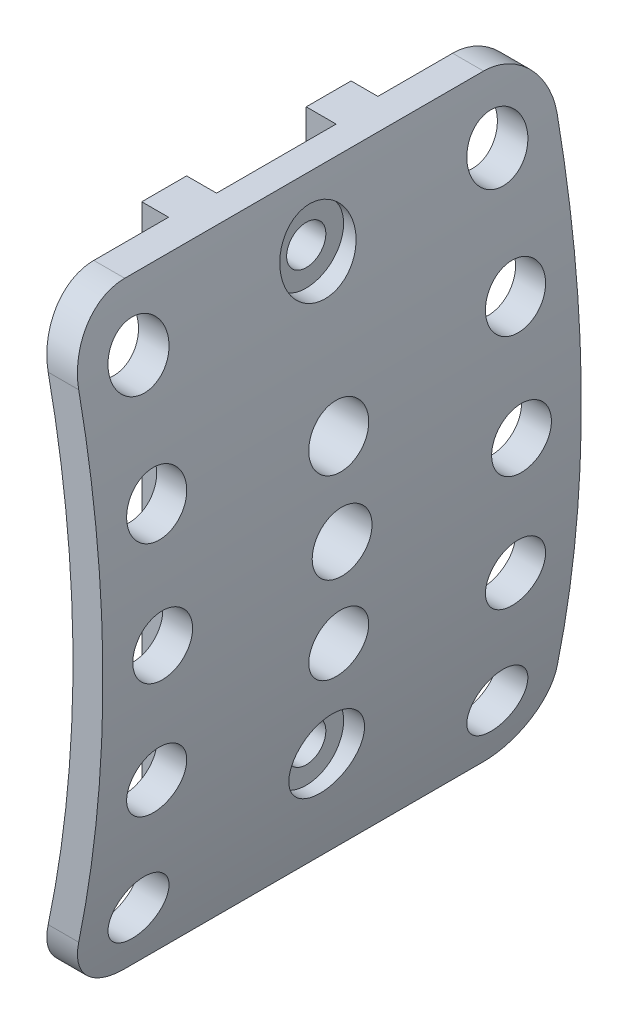
from build123d import *

# Parameters (mm, degrees)
BOSS_EXTRUDE1_DEPTH      = 25.4
BOSS_EXTRUDE1_DEPTH_BACK = 25.4
FILLET1_R                = 6.35
SKETCH4_R                = 2.0828
CUT_EXTRUDE1_DEPTH       = 42.910000161
SKETCH5_W                = 12.7
SKETCH5_H                = 95.659537334
CUT_EXTRUDE2_DEPTH       = 3.175
CUT_EXTRUDE3_DEPTH       = 14.2875
CUT_EXTRUDE4_START       = -36.5125
CUT_EXTRUDE4_DEPTH       = 14.2875
SKETCH7_R                = 3.175
CUT_EXTRUDE6_DEPTH       = 42.910000161
SKETCH8_R                = 3.96875
CUT_EXTRUDE7_DEPTH       = 3.81


# Read off the part's stored shape, not the designer's step: Split1
with BuildPart() as part:
    # Sketch2 → Boss-Extrude1 (new, two sides: drawn at the far end of the back side and taken through both)
    with BuildSketch(Plane.XY.offset(-BOSS_EXTRUDE1_DEPTH_BACK)):
        with BuildLine():
            Line((0, 0), (0, -31.75))
            Line((0, -31.75), (6.127221242, -31.75))
            ThreePointArc((6.127221242, -31.75), (10.16, 0), (6.127221242, 31.75))
            Line((6.127221242, 31.75), (0, 31.75))
            Line((0, 31.75), (0, 0))
        make_face()
    extrude(amount=BOSS_EXTRUDE1_DEPTH + BOSS_EXTRUDE1_DEPTH_BACK)

    # Fillet1
    fillet1_edges = [part.edges().sort_by_distance(p)[0] for p in [
        (3.063610621, -31.75, -25.4),
        (3.063610621, -31.75, 25.4),
        (3.063610621, 31.75, -25.4),
        (3.063610621, 31.75, 25.4),
    ]]
    fillet(fillet1_edges, radius=FILLET1_R)


with BuildPart() as body_2:
    # Split1: the piece on the far side of the plane
    add(part.part)
    split(bisect_by=Plane.XY.offset(-19.05), keep=Keep.BOTTOM)


with BuildPart() as part_1:
    add(part.part)

    # Split1
    split(bisect_by=Plane.XY.offset(-19.05), keep=Keep.TOP)

    # Sketch4 → Cut-Extrude1 (cut, symmetric)
    with BuildSketch(Plane.ZY):
        with Locations((0, 25.4)):
            Circle(SKETCH4_R)
    cut_extrude1 = extrude(amount=CUT_EXTRUDE1_DEPTH, both=True, mode=Mode.SUBTRACT)

    # Sketch5 → Cut-Extrude2 (cut)
    with BuildSketch(Plane.ZY):
        Rectangle(SKETCH5_W, SKETCH5_H)
    extrude(amount=-CUT_EXTRUDE2_DEPTH, mode=Mode.SUBTRACT)


with BuildPart() as cut_extrude3_tool:
    # Sketch6 → Cut-Extrude3 (new body)
    with BuildSketch(Plane(origin=(0, 0, -25.4), x_dir=(-1, 0, 0), z_dir=(0, 0, -1))):
        with BuildLine():
            Line((0, 41.000549082), (0, -41.000549082))
            ThreePointArc((0, -41.000549082), (-6.985, 0), (0, 41.000549082))
        make_face()
    extrude(amount=-CUT_EXTRUDE3_DEPTH)


with BuildPart() as part_2:
    add(part_1.part)

    # Cut-Extrude3: cut by cut_extrude3_tool
    add(cut_extrude3_tool.part, mode=Mode.SUBTRACT)

    # Sketch6<2> → Cut-Extrude4 (cut)
    with BuildSketch(Plane(origin=(0, 0, -25.4), x_dir=(-1, 0, 0), z_dir=(0, 0, -1)).offset(CUT_EXTRUDE4_START)):
        with BuildLine():
            Line((0, 41.000549082), (0, -41.000549082))
            ThreePointArc((0, -41.000549082), (-6.985, 0), (0, 41.000549082))
        make_face()
    extrude(amount=-CUT_EXTRUDE4_DEPTH, mode=Mode.SUBTRACT)


with BuildPart() as body_2_1:
    add(body_2.part)

    # Cut-Extrude3: cut by cut_extrude3_tool
    add(cut_extrude3_tool.part, mode=Mode.SUBTRACT)


with BuildPart() as cut_extrude6_tool:
    # Sketch7 → Cut-Extrude6 (new, through all)
    with BuildSketch(Plane(origin=(0, 0, 0), x_dir=(0, 0, -1), z_dir=(1, 0, 0))):
        with Locations(Location((0, -9.525, 0), (0, 0, 180))):
            Circle(SKETCH7_R)
        with Locations((19.05, -25.4)):
            Circle(SKETCH7_R)
        with Locations(Location((-19.05, -25.4, 0), (0, 0, 180))):
            Circle(SKETCH7_R)
        with Locations((19.05, -12.7)):
            Circle(SKETCH7_R)
        with Locations(Location((-19.05, -12.7, 0), (0, 0, 180))):
            Circle(SKETCH7_R)
        with Locations((19.05, 0)):
            Circle(SKETCH7_R)
        with Locations(Location((-19.05, 0, 0), (0, 0, 180))):
            Circle(SKETCH7_R)
        with Locations((19.05, 12.7)):
            Circle(SKETCH7_R)
        with Locations(Location((-19.05, 12.7, 0), (0, 0, 180))):
            Circle(SKETCH7_R)
        with Locations((19.05, 25.4)):
            Circle(SKETCH7_R)
        with Locations(Location((-19.05, 25.4, 0), (0, 0, 180))):
            Circle(SKETCH7_R)
        with Locations(Location((0, 0, 0), (0, 0, 180))):
            Circle(SKETCH7_R)
        with Locations(Location((0, 9.525, 0), (0, 0, 180))):
            Circle(SKETCH7_R)
    extrude(amount=CUT_EXTRUDE6_DEPTH)


with BuildPart() as part_3:
    add(part_2.part)

    # Cut-Extrude6: cut by cut_extrude6_tool
    add(cut_extrude6_tool.part, mode=Mode.SUBTRACT)

    # Sketch8 → Cut-Extrude7 (cut)
    with BuildSketch(Plane(origin=(10.16, 0, 0), x_dir=(0, 0, -1), z_dir=(1, 0, 0))):
        with Locations((0, 25.4)):
            Circle(SKETCH8_R)
    cut_extrude7 = extrude(amount=-CUT_EXTRUDE7_DEPTH, mode=Mode.SUBTRACT)


with BuildPart() as body_2_2:
    add(body_2_1.part)

    # Cut-Extrude6: cut by cut_extrude6_tool
    add(cut_extrude6_tool.part, mode=Mode.SUBTRACT)

    # too late for niceness: union part
    add(part_3.part)

    # Mirror1: Cut-Extrude1, Cut-Extrude7 across plane
    add(cut_extrude1.mirror(Plane.ZX.offset(2.54)), mode=Mode.SUBTRACT)
    add(cut_extrude7.mirror(Plane.ZX.offset(2.54)), mode=Mode.SUBTRACT)


solid = body_2_2.part
